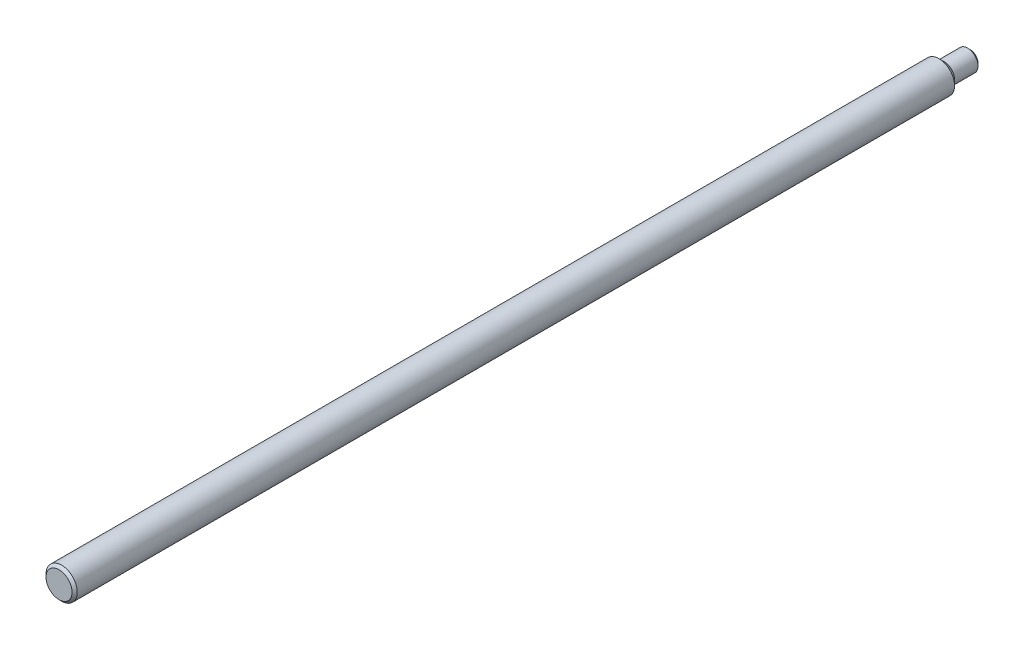
from build123d import *

# Parameters (mm, degrees)
SCHIZZO1_R                   = 6
ESTRUSIONE_ESTRUSIONE1_DEPTH = 350
SMUSSO1_SIZE                 = 1


with BuildPart() as part:
    # Schizzo1 → Estrusione-Estrusione1 (new body)
    with BuildSketch(Plane.XY):
        Circle(SCHIZZO1_R)
    extrude(amount=ESTRUSIONE_ESTRUSIONE1_DEPTH)

    # Schizzo2 → Taglia-Rivoluzione1 (revolve, cut)
    with BuildSketch(Plane(origin=(0, 0, 0), x_dir=(1, 0, 0), z_dir=(0, 1, 0))):
        Polygon((-4, -10), (-6, -12), (-6, 0), (-4, 0), align=None)
    revolve(axis=Axis((0, 0, -1.898721367), (0, 0, 1)), mode=Mode.SUBTRACT)

    # Smusso1
    smusso1_edges = [part.edges().sort_by_distance(p)[0] for p in [
        (4, 0, 0),
        (-6, 0, 350),
    ]]
    chamfer(smusso1_edges, length=SMUSSO1_SIZE)


solid = part.part
